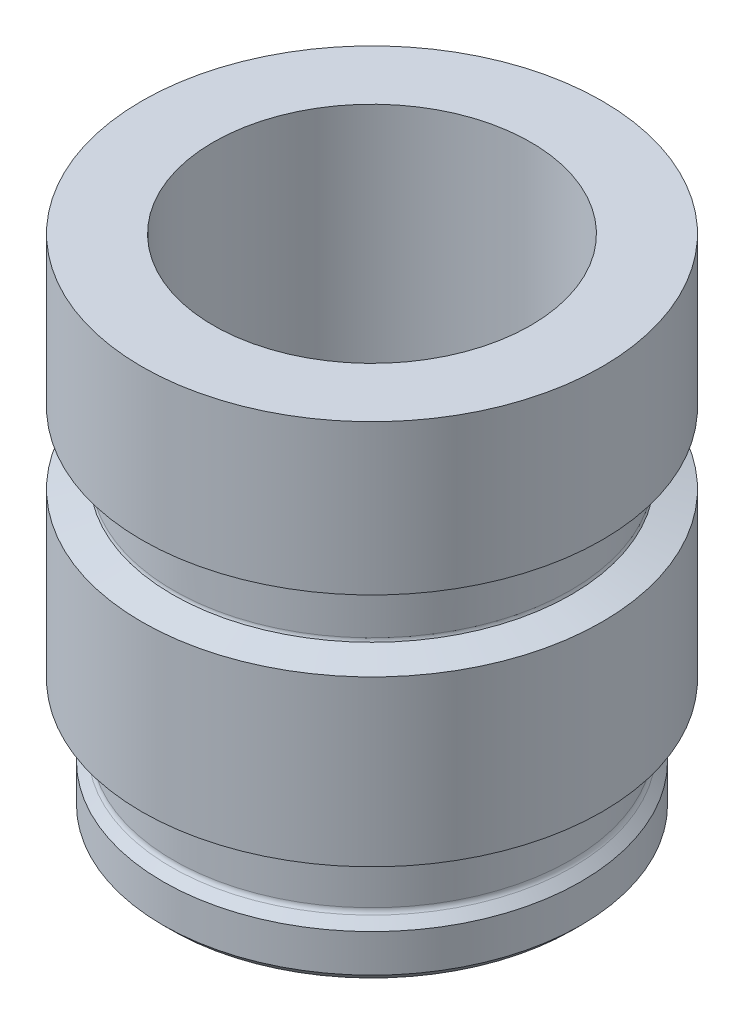
from build123d import *

# Parameters (mm, degrees)
SKETCH3_W                 = 4.35
SKETCH3_H                 = 3.42
SKETCH_PATTERN1_START     = -2.691666667
SKETCH_PATTERN1_OUTLINE_R = 4.35
SKETCH_PATTERN1_DEPTH     = 3.42
SKETCH14_R                = 4.35
CUT_EXTRUDE5_DEPTH        = 0.4275
SKETCH17_OUTSIDE_W        = 88.114
SKETCH17_OUTSIDE_H        = 88.114
SKETCH17_OUTSIDE_R        = 3.768125
CUT_EXTRUDE8_DEPTH        = 9.955029662
CUT_EXTRUDE8_DRAFT        = -75
SKETCH18_OUTSIDE_W        = 82.758
SKETCH18_OUTSIDE_H        = 82.758
SKETCH18_OUTSIDE_R        = 3.768125
CUT_EXTRUDE9_DEPTH        = 9.237544301
CUT_EXTRUDE9_DRAFT        = -75
SKETCH19_OUTSIDE_W        = 93.34
SKETCH19_OUTSIDE_H        = 93.34
SKETCH19_OUTSIDE_R        = 3.768125
CUT_EXTRUDE10_DEPTH       = 10.655226708
CUT_EXTRUDE10_DRAFT       = -75
SKETCH7_R                 = 3
CUT_EXTRUDE1_DEPTH        = 12.317906167
CHAMFER1_SIZE             = 0.158
FILLET2_R                 = 0.1305


# Read off the part's stored shape, not the designer's step: Sketch-Pattern1
with BuildPart() as part:
    # Sketch3 → Revolve1 (revolve)
    with BuildSketch(Plane.XY):
        with Locations((2.175, 3.04)):
            Rectangle(SKETCH3_W, SKETCH3_H)
    revolve(axis=Axis((0, 1.33, 0), (0, 1, 0)))

    # Sketch14 → Cut-Extrude5 (cut)
    with BuildSketch(Plane.XZ.offset(-1.33)):
        Circle(SKETCH14_R)
    extrude(amount=-CUT_EXTRUDE5_DEPTH, mode=Mode.SUBTRACT)


with BuildPart() as body_2:
    # Sketch6 → Revolve2 (revolve)
    with BuildSketch(Plane.XY):
        Polygon((3.7525, 0.728333333), (3.7525, -2.691666667), (3.7525, -3.720833333), (3.95, -3.720833333), (3.95, -4.75), (0, -4.75), (0, 1.7575), (3.7525, 1.7575), align=None)
    revolve(axis=Axis((0, -4.75, 0), (0, 1, 0)))


with BuildPart() as body_3:
    # Sketch-Pattern1 outline → Sketch-Pattern1 (new body)
    with BuildSketch(Plane(origin=(0, 0, 0), x_dir=(1, 0, 0), z_dir=(0, 1, 0)).offset(SKETCH_PATTERN1_START)):
        Circle(SKETCH_PATTERN1_OUTLINE_R)
    extrude(amount=SKETCH_PATTERN1_DEPTH)


with BuildPart() as body_4:
    # Mirror3: mirrored copy
    add(body_3.part.mirror(Plane.XY))


with BuildPart() as cut_extrude8_tool:
    # Sketch17 outside → Cut-Extrude8 (with draft: the straight prism first)
    with BuildSketch(Plane.XZ.offset(-1.7575)):
        Rectangle(SKETCH17_OUTSIDE_W, SKETCH17_OUTSIDE_H)
        Circle(SKETCH17_OUTSIDE_R, mode=Mode.SUBTRACT)
    extrude(amount=-CUT_EXTRUDE8_DEPTH)
    # Cut-Extrude8: the draft: its side faces are tilted about the plane it starts from
    cut_extrude8_sides = [cut_extrude8_tool.faces().sort_by_distance(p)[0] for p in [
        (0, 6.735014831, -44.057),
        (44.057, 6.735014831, 0),
        (0, 6.735014831, 44.057),
        (-44.057, 6.735014831, 0),
        (-3.768125, 6.735014831, 0),
    ]]
    draft(cut_extrude8_sides, Plane.XZ.offset(-1.7575), CUT_EXTRUDE8_DRAFT)


with BuildPart() as part_1:
    add(part.part)

    # Cut-Extrude8: cut by cut_extrude8_tool
    add(cut_extrude8_tool.part, mode=Mode.SUBTRACT)


with BuildPart() as cut_extrude9_tool:
    # Sketch18 outside → Cut-Extrude9 (with draft: the straight prism first)
    with BuildSketch(Plane(origin=(0, 0.728333333, 0), x_dir=(1, 0, 0), z_dir=(0, 1, 0))):
        Rectangle(SKETCH18_OUTSIDE_W, SKETCH18_OUTSIDE_H)
        Circle(SKETCH18_OUTSIDE_R, mode=Mode.SUBTRACT)
    extrude(amount=-CUT_EXTRUDE9_DEPTH)
    # Cut-Extrude9: the draft: its side faces are tilted about the plane it starts from
    cut_extrude9_sides = [cut_extrude9_tool.faces().sort_by_distance(p)[0] for p in [
        (0, -3.890438817, 41.379),
        (41.379, -3.890438817, 0),
        (0, -3.890438817, -41.379),
        (-41.379, -3.890438817, 0),
        (-3.768125, -3.890438817, 0),
    ]]
    draft(cut_extrude9_sides, Plane(origin=(0, 0.728333333, 0), x_dir=(1, 0, 0), z_dir=(0, 1, 0)), CUT_EXTRUDE9_DRAFT)


with BuildPart() as body_4_1:
    add(body_4.part)

    # Cut-Extrude9: cut by cut_extrude9_tool
    add(cut_extrude9_tool.part, mode=Mode.SUBTRACT)


with BuildPart() as cut_extrude10_tool:
    # Sketch19 outside → Cut-Extrude10 (with draft: the straight prism first)
    with BuildSketch(Plane.XZ.offset(2.691666667)):
        Rectangle(SKETCH19_OUTSIDE_W, SKETCH19_OUTSIDE_H)
        Circle(SKETCH19_OUTSIDE_R, mode=Mode.SUBTRACT)
    extrude(amount=-CUT_EXTRUDE10_DEPTH)
    # Cut-Extrude10: the draft: its side faces are tilted about the plane it starts from
    cut_extrude10_sides = [cut_extrude10_tool.faces().sort_by_distance(p)[0] for p in [
        (0, 2.635946687, -46.67),
        (46.67, 2.635946687, 0),
        (0, 2.635946687, 46.67),
        (-46.67, 2.635946687, 0),
        (-3.768125, 2.635946687, 0),
    ]]
    draft(cut_extrude10_sides, Plane.XZ.offset(2.691666667), CUT_EXTRUDE10_DRAFT)


with BuildPart() as body_4_2:
    add(body_4_1.part)

    # Cut-Extrude10: cut by cut_extrude10_tool
    add(cut_extrude10_tool.part, mode=Mode.SUBTRACT)


with BuildPart() as cut_extrude1_tool:
    # Sketch7 → Cut-Extrude1 (new, through all)
    with BuildSketch(Plane(origin=(0, 4.75, 0), x_dir=(1, 0, 0), z_dir=(0, 1, 0))):
        with Locations(Location((0, 0, 0), (0, 0, 180))):
            Circle(SKETCH7_R)
    extrude(amount=-CUT_EXTRUDE1_DEPTH)


with BuildPart() as part_2:
    add(part_1.part)

    # Cut-Extrude1: cut by cut_extrude1_tool
    add(cut_extrude1_tool.part, mode=Mode.SUBTRACT)


with BuildPart() as body_2_1:
    add(body_2.part)

    # Cut-Extrude1: cut by cut_extrude1_tool
    add(cut_extrude1_tool.part, mode=Mode.SUBTRACT)


with BuildPart() as body_4_3:
    add(body_4_2.part)

    # Cut-Extrude1: cut by cut_extrude1_tool
    add(cut_extrude1_tool.part, mode=Mode.SUBTRACT)


with BuildPart() as part_3:
    add(part_2.part)

    # Combine1: union body 4, body 2
    add(body_4_3.part)
    add(body_2_1.part)

    # Chamfer1
    chamfer1_edges = [part_3.edges().sort_by_distance(p)[0] for p in [
        (-3.95, -3.720833333, 0),
        (-3.95, -4.75, 0),
    ]]
    chamfer(chamfer1_edges, length=CHAMFER1_SIZE)

    # Fillet2
    # the kernel refuses this fillet: 0.1305 mm, written as the material it adds along each edge
    with BuildSketch(Plane(origin=(0, 1.7575, 0), x_dir=(1, 0, 0), z_dir=(0, 0, 1))) as fillet2_piece_1:
        with BuildLine():
            CenterArc((3.883, -0.061919176), FILLET2_R, 151.674733073, 28.325266927)
            Line((3.7525, -0.061919176), (3.74989, -0.061919176))
            Line((3.74989, -0.061919176), (3.74989, 0))
            Line((3.74989, 0), (3.7525, 0.00261))
            ThreePointArc((3.7525, 0.00261), (3.7603125, 0.00261), (3.7658275, 0.001238384))
            Line((3.7658275, 0.001238384), (3.768125, 0))
        make_face()
    revolve(axis=Axis((0, 1.7575, 0), (0, 1, 0)))
    with BuildSketch(Plane(origin=(0, -2.691666667, 0), x_dir=(1, 0, 0), z_dir=(0, 0, -1))) as fillet2_piece_2:
        with BuildLine():
            CenterArc((3.883, 0.061919176), FILLET2_R, 180, 28.325266927)
            Line((3.768125, 0), (3.7658275, -0.001238384))
            ThreePointArc((3.7658275, -0.001238384), (3.7603125, -0.00261), (3.7525, -0.00261))
            Line((3.7525, -0.00261), (3.74989, 0))
            Line((3.74989, 0), (3.74989, 0.061919176))
            Line((3.74989, 0.061919176), (3.7525, 0.061919176))
        make_face()
    revolve(axis=Axis((0, -2.691666667, 0), (0, -1, 0)))
    with BuildSketch(Plane(origin=(0, -3.720833333, 0), x_dir=(1, 0, 0), z_dir=(0, 0, 1))) as fillet2_piece_3:
        with BuildLine():
            CenterArc((3.883, 0.093537426), FILLET2_R, 180, 45.78777852)
            Line((3.7525, 0.093537426), (3.74989, 0.093537426))
            Line((3.74989, 0.093537426), (3.74989, 0))
            Line((3.74989, 0), (3.7525, -0.00261))
            ThreePointArc((3.7525, -0.00261), (3.77225, -0.00261), (3.79018, -0.001870749))
            Line((3.79018, -0.001870749), (3.792, 0))
        make_face()
    revolve(axis=Axis((0, -3.720833333, 0), (0, 1, 0)))
    with BuildSketch(Plane(origin=(0, 0.728333333, 0), x_dir=(1, 0, 0), z_dir=(0, 0, -1))) as fillet2_piece_4:
        with BuildLine():
            CenterArc((3.883, -0.061919176), FILLET2_R, 151.674733073, 28.325266927)
            Line((3.768125, 0), (3.7658275, 0.001238383))
            ThreePointArc((3.7658275, 0.001238383), (3.7603125, 0.00261), (3.7525, 0.00261))
            Line((3.7525, 0.00261), (3.74989, 0))
            Line((3.74989, 0), (3.74989, -0.061919176))
            Line((3.74989, -0.061919176), (3.7525, -0.061919176))
        make_face()
    revolve(axis=Axis((0, 0.728333333, 0), (0, -1, 0)))


solid = part_3.part
